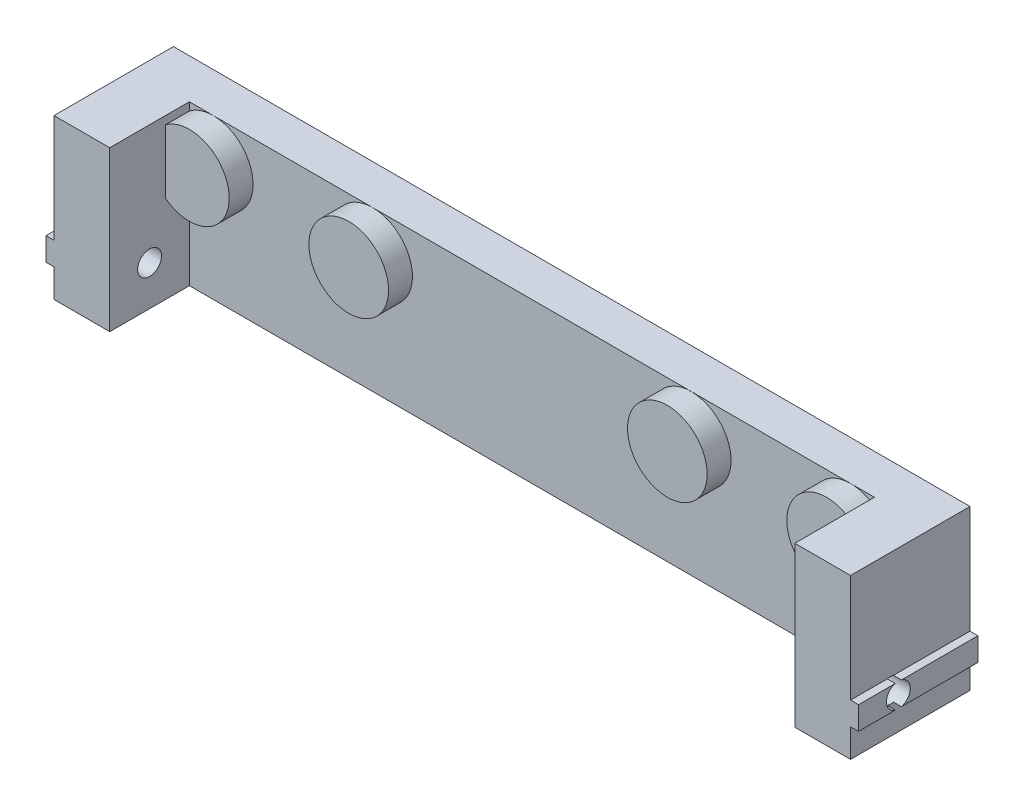
from build123d import *

# Parameters (mm, degrees)
MAIN_DEPTH               = 15
SKETCH2_W                = 86
SKETCH2_H                = 20
TOPEXTRUSION_DEPTH       = 10
SKETCH5_R                = 5
REINFORCEMENTHOLES_DEPTH = 3
SKETCH3_R                = 3
HOLES_DEPTH              = 5
SKETCH4_R                = 1.5
FIXHOLES_DEPTH           = 106.019045892


with BuildPart() as part:
    # Sketch1 → Main (new body)
    with BuildSketch(Plane.XY):
        Polygon((-50, 0), (50, 0), (50, 3.55), (51, 3.55), (51, 6.45), (50, 6.45), (50, 20), (-50, 20), (-50, 6.45), (-51, 6.45), (-51, 3.55), (-50, 3.55), align=None)
    extrude(amount=MAIN_DEPTH)

    # Sketch2 → TopExtrusion (cut)
    with BuildSketch(Plane.XY.offset(15)):
        with Locations((0, 10)):
            Rectangle(SKETCH2_W, SKETCH2_H)
    extrude(amount=-TOPEXTRUSION_DEPTH, mode=Mode.SUBTRACT)

    # Sketch5 → ReinforcementHoles (add)
    with BuildSketch(Plane.XY.offset(5)):
        with Locations((-40, 15)):
            Circle(SKETCH5_R)
        with Locations((-20, 15)):
            Circle(SKETCH5_R)
        with Locations((20, 15)):
            Circle(SKETCH5_R)
        with Locations((40, 15)):
            Circle(SKETCH5_R)
    extrude(amount=REINFORCEMENTHOLES_DEPTH)

    # Sketch3 → Holes (cut)
    with BuildSketch(Plane.XY):
        with Locations((-40, 15)):
            Circle(SKETCH3_R)
        with Locations((20, 15)):
            Circle(SKETCH3_R)
    holes = extrude(amount=HOLES_DEPTH, mode=Mode.SUBTRACT)

    # Mirror1: Holes across plane
    add(holes.mirror(Plane(origin=(0, 0, 0), x_dir=(0, 0, 1), z_dir=(1, 0, 0))), mode=Mode.SUBTRACT)

    # Sketch4 → FixHoles (cut, through all)
    with BuildSketch(Plane(origin=(51, 0, 0), x_dir=(0, 0, -1), z_dir=(1, 0, 0))):
        with Locations((-10, 5)):
            Circle(SKETCH4_R)
    extrude(amount=-FIXHOLES_DEPTH, mode=Mode.SUBTRACT)


solid = part.part
